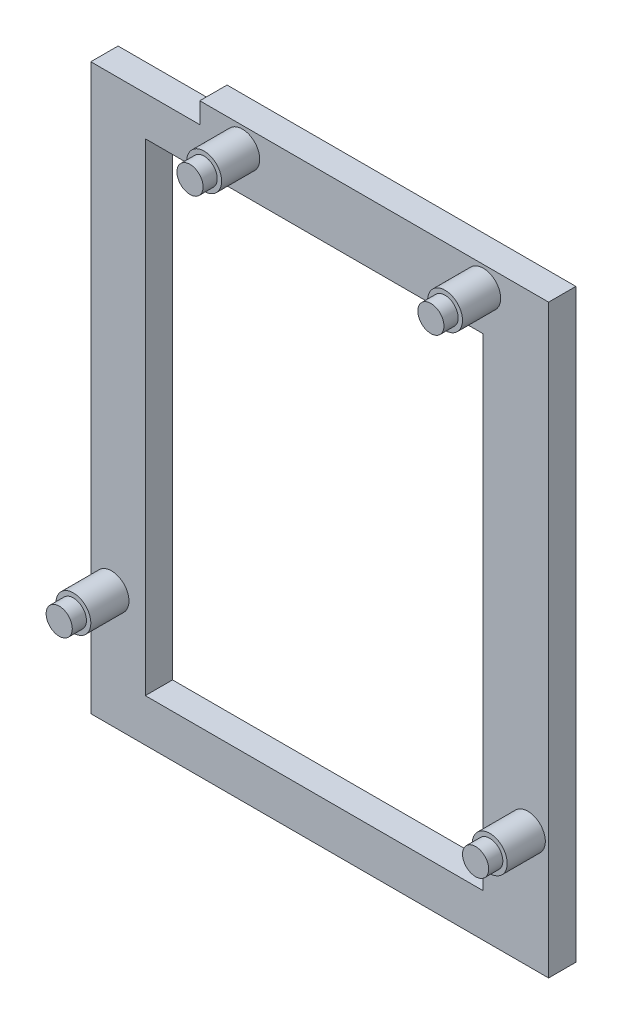
from build123d import *

# Parameters (mm, degrees)
SKETCH1_R           = 2.032
SKETCH1_W           = 33.02
SKETCH1_H           = 52.3843179
BOSS_EXTRUDE1_DEPTH = 3.175
SKETCH1_3_R         = 2.032
SKETCH1_3_R_2       = 1.524
BOSS_EXTRUDE2_DEPTH = 7.62
SKETCH1_4_R         = 1.524
BOSS_EXTRUDE3_DEPTH = 9.271
CUT_EXTRUDE1_DEPTH  = 9.271


with BuildPart() as part:
    # Sketch1 → Boss-Extrude1 (new body)
    with BuildSketch(Plane.XY):
        Polygon((0, 65.786), (0, 0), (53.34, 0), (53.34, 65.786), (53.34, 68.199), (45.72, 68.199), (12.7, 68.199), (12.7, 65.786), align=None)
        with Locations((2.413, 13.589)):
            Circle(SKETCH1_R, mode=Mode.SUBTRACT)
        with Locations((50.927, 13.589)):
            Circle(SKETCH1_R, mode=Mode.SUBTRACT)
        with Locations((29.21, 31.18869335)):
            Rectangle(SKETCH1_W, SKETCH1_H, mode=Mode.SUBTRACT)
        with Locations((17.653, 65.786)):
            Circle(SKETCH1_R, mode=Mode.SUBTRACT)
        with Locations((45.72, 65.786)):
            Circle(SKETCH1_R, mode=Mode.SUBTRACT)
    extrude(amount=BOSS_EXTRUDE1_DEPTH)

    # Sketch1<3> → Boss-Extrude2 (add)
    # profile 1 of 4: a face of its own
    with BuildSketch(Plane.XY):
        with Locations((50.927, 13.589)):
            Circle(SKETCH1_3_R)
        with Locations((50.927, 13.589)):
            Circle(SKETCH1_3_R_2, mode=Mode.SUBTRACT)
    # profile 2 of 4: a face of its own
    with BuildSketch(Plane.XY):
        with Locations((2.413, 13.589)):
            Circle(SKETCH1_3_R)
        with Locations((2.413, 13.589)):
            Circle(SKETCH1_3_R_2, mode=Mode.SUBTRACT)
    # profile 3 of 4: a face of its own
    with BuildSketch(Plane.XY):
        with Locations((17.653, 65.786)):
            Circle(SKETCH1_3_R)
        with Locations((17.653, 65.786)):
            Circle(SKETCH1_3_R_2, mode=Mode.SUBTRACT)
    # profile 4 of 4: a face of its own
    with BuildSketch(Plane.XY):
        with Locations((45.72, 65.786)):
            Circle(SKETCH1_3_R)
        with Locations((45.72, 65.786)):
            Circle(SKETCH1_3_R_2, mode=Mode.SUBTRACT)
    extrude(amount=BOSS_EXTRUDE2_DEPTH)

    # Sketch1<4> → Boss-Extrude3 (add)
    with BuildSketch(Plane.XY):
        with Locations((17.653, 65.786)):
            Circle(SKETCH1_4_R)
        with Locations((45.72, 65.786)):
            Circle(SKETCH1_4_R)
        with Locations((50.927, 13.589)):
            Circle(SKETCH1_4_R)
        with Locations((2.413, 13.589)):
            Circle(SKETCH1_4_R)
    extrude(amount=BOSS_EXTRUDE3_DEPTH)

    # Sketch2 → Cut-Extrude1 (cut)
    with BuildSketch(Plane.XY.offset(3.175)):
        Polygon((6.35, 4.9965344), (12.7, 4.9965344), (12.7, 57.3808523), (45.72, 57.3808523), (45.72, 61.1908523), (6.35, 61.1908523), align=None)
    extrude(amount=-CUT_EXTRUDE1_DEPTH, mode=Mode.SUBTRACT)


solid = part.part
